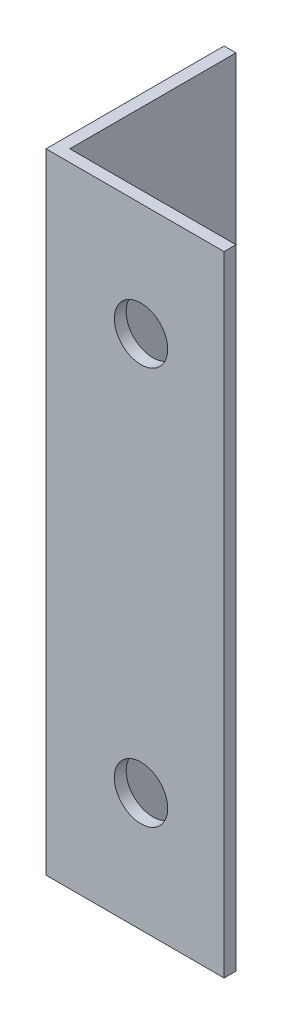
from build123d import *

# Parameters (mm, degrees)
EXTRUDE_1_DEPTH     = 53
SKETCH_2_R          = 2.25
CUT_EXTRUDE_1_DEPTH = 57.833088954


with BuildPart() as part:
    # Эскиз1 → Бобышка-Вытянуть1 (new body)
    with BuildSketch(Plane(origin=(0, 0, 0), x_dir=(1, 0, 0), z_dir=(0, 1, 0))):
        Polygon((0, 0), (0, 15), (1, 15), (1, 1), (15, 1), (15, 0), align=None)
    extrude(amount=EXTRUDE_1_DEPTH)

    # Эскиз2 → Вырез-Вытянуть1 (cut, through all)
    with BuildSketch(Plane(origin=(0, 0, -1), x_dir=(-1, 0, 0), z_dir=(0, 0, -1))):
        with Locations((-8, 10)):
            Circle(SKETCH_2_R)
        with Locations((-8, 43.5)):
            Circle(SKETCH_2_R)
    extrude(amount=-CUT_EXTRUDE_1_DEPTH, mode=Mode.SUBTRACT)


solid = part.part
